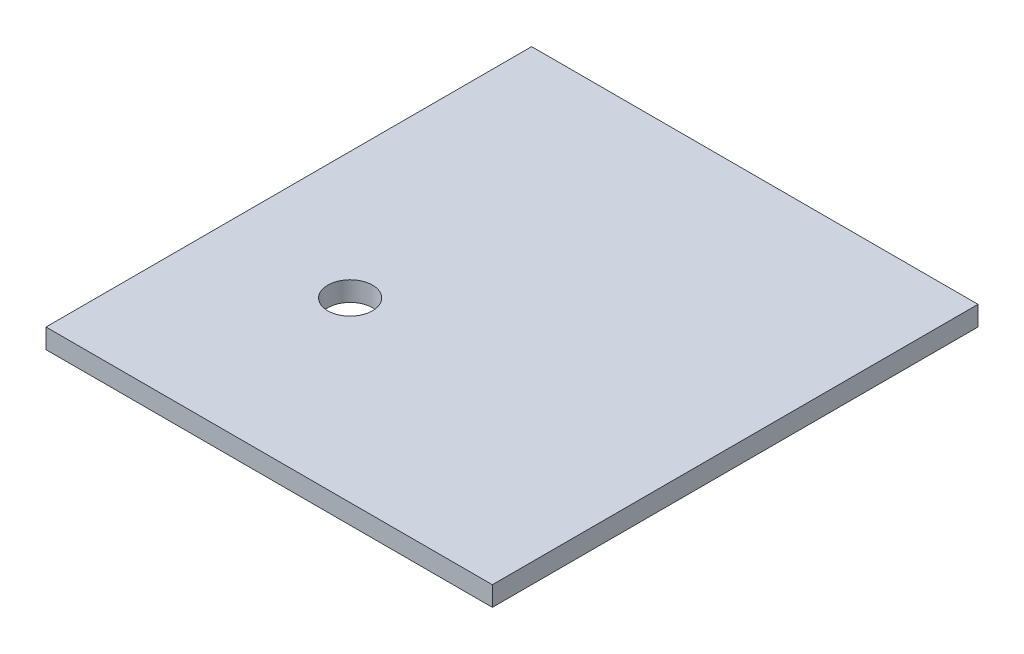
from build123d import *

# Parameters (mm, degrees)
SKETCH1_W           = 127
SKETCH1_H           = 138.176
SKETCH1_R           = 6.35
BOSS_EXTRUDE1_DEPTH = 5.588


with BuildPart() as part:
    # Sketch1 → Boss-Extrude1 (new body)
    with BuildSketch(Plane(origin=(0, 0, 0), x_dir=(1, 0, 0), z_dir=(0, 1, 0))):
        Rectangle(SKETCH1_W, SKETCH1_H)
        with Locations((-27.392718101, -18.661332369)):
            Circle(SKETCH1_R, mode=Mode.SUBTRACT)
    extrude(amount=BOSS_EXTRUDE1_DEPTH)


solid = part.part
